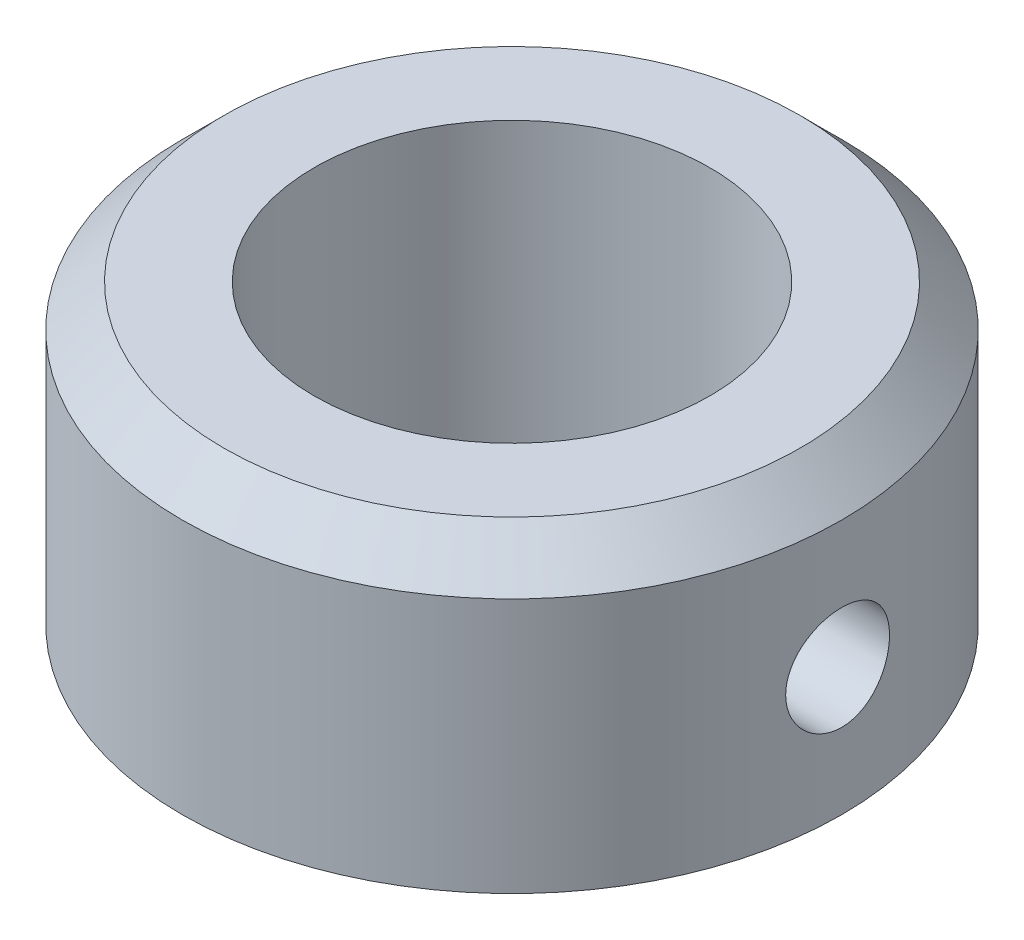
from build123d import *

# Parameters (mm, degrees)
SKETCH1_R              = 15.875
SKETCH1_R_2            = 9.525
BOSS_EXTRUDE1_DEPTH    = 14.2875
CHAMFER1_SIZE          = 2
CUT_EXTRUDE1_START     = 9.191062133
CUT_EXTRUDE1_OUTLINE_R = 2.5
CUT_EXTRUDE1_DEPTH     = 6.683937969


# Read off the part's stored shape, not the designer's step: Cut-Extrude1
with BuildPart() as part:
    # Sketch1 → Boss-Extrude1 (new body)
    with BuildSketch(Plane(origin=(0, 0, 0), x_dir=(1, 0, 0), z_dir=(0, 1, 0))):
        with Locations(Location((0, 0, 0), (0, 0, 270))):
            Circle(SKETCH1_R)
        with Locations(Location((0, 0, 0), (0, 0, 270))):
            Circle(SKETCH1_R_2, mode=Mode.SUBTRACT)
    extrude(amount=BOSS_EXTRUDE1_DEPTH)

    # Chamfer1
    chamfer1_edges = [part.edges().sort_by_distance(p)[0] for p in [
        (0, 14.2875, -15.875),
    ]]
    chamfer(chamfer1_edges, length=CHAMFER1_SIZE)

    # Cut-Extrude1 outline → Cut-Extrude1 (cut)
    with BuildSketch(Plane.YZ.offset(CUT_EXTRUDE1_START)):
        with Locations((6.14375, 0)):
            Circle(CUT_EXTRUDE1_OUTLINE_R)
    extrude(amount=CUT_EXTRUDE1_DEPTH, mode=Mode.SUBTRACT)


solid = part.part
